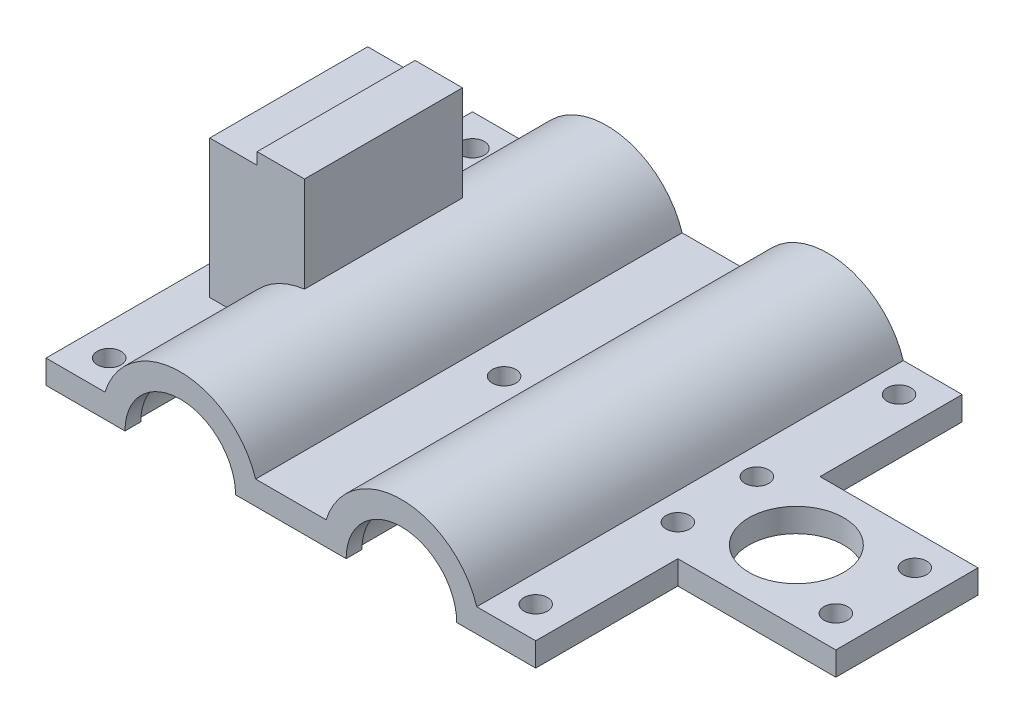
from build123d import *

# Parameters (mm, degrees)
BOSS_EXTRUDE1_DEPTH = 27
BOSS_EXTRUDE2_DEPTH = 2
BOSS_EXTRUDE3_DEPTH = 1
SKETCH4_R           = 1.5
CUT_EXTRUDE1_DEPTH  = 42.701318924
SKETCH5_W           = 27.460607986
SKETCH5_H           = 18
BOSS_EXTRUDE4_DEPTH = 3
SKETCH6_R           = 1.5
SKETCH6_R_2         = 6
CUT_EXTRUDE2_DEPTH  = 59.129166517
BOSS_EXTRUDE5_DEPTH = 10
SKETCH8_W           = 6
SKETCH8_H           = 1.5
BOSS_EXTRUDE6_DEPTH = 20


with BuildPart() as part:
    # Sketch1 → Boss-Extrude1 (new, symmetric)
    with BuildSketch(Plane.XY):
        with BuildLine():
            Line((-31, 3), (-23.539392014, 3))
            ThreePointArc((-23.539392014, 3), (-14, 10), (-4.460607986, 3))
            Line((-4.460607986, 3), (4.460607986, 3))
            ThreePointArc((4.460607986, 3), (14, 10), (23.539392014, 3))
            Line((23.539392014, 3), (31, 3))
            Line((31, 3), (31, 0))
            Line((31, 0), (21.5, 0))
            ThreePointArc((21.5, 0), (14, 7.5), (6.5, 0))
            Line((6.5, 0), (-6.5, 0))
            ThreePointArc((-6.5, 0), (-14, 7.5), (-21.5, 0))
            Line((-21.5, 0), (-31, 0))
            Line((-31, 0), (-31, 3))
        make_face()
    extrude(amount=BOSS_EXTRUDE1_DEPTH, both=True)

    # Sketch2 → Boss-Extrude2 (add)
    with BuildSketch(Plane.XY.offset(27)):
        with BuildLine():
            Line((-22, 0), (-21, 0))
            ThreePointArc((-21, 0), (-14, 7), (-7, 0))
            Line((-7, 0), (-6, 0))
            ThreePointArc((-6, 0), (-14, 8), (-22, 0))
        make_face()
        with BuildLine():
            Line((21, 0), (22, 0))
            ThreePointArc((22, 0), (14, 8), (6, 0))
            Line((6, 0), (7, 0))
            ThreePointArc((7, 0), (14, 7), (21, 0))
        make_face()
    boss_extrude2 = extrude(amount=-BOSS_EXTRUDE2_DEPTH)

    # Mirror1: Boss-Extrude2 across plane
    add(boss_extrude2.mirror(Plane.XY))

    # Sketch3 → Boss-Extrude3 (add, symmetric)
    with BuildSketch(Plane.XY):
        with BuildLine():
            Line((-22, 0), (-21, 0))
            ThreePointArc((-21, 0), (-14, 7), (-7, 0))
            Line((-7, 0), (-6, 0))
            ThreePointArc((-6, 0), (-14, 8), (-22, 0))
        make_face()
        with BuildLine():
            Line((6, 0), (7, 0))
            ThreePointArc((7, 0), (14, 7), (21, 0))
            Line((21, 0), (22, 0))
            ThreePointArc((22, 0), (14, 8), (6, 0))
        make_face()
    extrude(amount=BOSS_EXTRUDE3_DEPTH, both=True)

    # Sketch4 → Cut-Extrude1 (cut, through all)
    with BuildSketch(Plane(origin=(0, 3, 0), x_dir=(1, 0, 0), z_dir=(0, 1, 0))):
        with Locations((-27, 23)):
            Circle(SKETCH4_R)
        with Locations((-27, -23)):
            Circle(SKETCH4_R)
        with Locations((27, -23)):
            Circle(SKETCH4_R)
        with Locations((27, 23)):
            Circle(SKETCH4_R)
        Circle(SKETCH4_R)
    extrude(amount=-CUT_EXTRUDE1_DEPTH, mode=Mode.SUBTRACT)

    # Sketch5 → Boss-Extrude4 (add)
    with BuildSketch(Plane(origin=(0, 3, 0), x_dir=(1, 0, 0), z_dir=(0, 1, 0))):
        with Locations((37.269696007, 0)):
            Rectangle(SKETCH5_W, SKETCH5_H)
    extrude(amount=-BOSS_EXTRUDE4_DEPTH)

    # Sketch6 → Cut-Extrude2 (cut, through all)
    with BuildSketch(Plane(origin=(0, 3, 0), x_dir=(1, 0, 0), z_dir=(0, 1, 0))):
        with Locations((47, 5)):
            Circle(SKETCH6_R)
        with Locations((47, -5)):
            Circle(SKETCH6_R)
        with Locations((27, -5)):
            Circle(SKETCH6_R)
        with Locations((27, 5)):
            Circle(SKETCH6_R)
        with Locations((37, 0)):
            Circle(SKETCH6_R_2)
    extrude(amount=-CUT_EXTRUDE2_DEPTH, mode=Mode.SUBTRACT)

    # Sketch7 → Boss-Extrude5 (add, symmetric)
    with BuildSketch(Plane.XY):
        with BuildLine():
            Line((-27.269696007, 3), (-23.539392014, 3))
            ThreePointArc((-23.539392014, 3), (-20.416966951, 7.669585071), (-15.269696007, 9.919066088))
            Line((-15.269696007, 9.919066088), (-15.269696007, 20.5))
            Line((-15.269696007, 20.5), (-27.269696007, 20.5))
            Line((-27.269696007, 20.5), (-27.269696007, 3))
        make_face()
    extrude(amount=BOSS_EXTRUDE5_DEPTH, both=True)

    # Sketch8 → Boss-Extrude6 (add)
    with BuildSketch(Plane(origin=(0, 0, -10), x_dir=(-1, 0, 0), z_dir=(0, 0, -1))):
        with Locations((18.269696007, 21.25)):
            Rectangle(SKETCH8_W, SKETCH8_H)
    extrude(amount=-BOSS_EXTRUDE6_DEPTH)


solid = part.part
